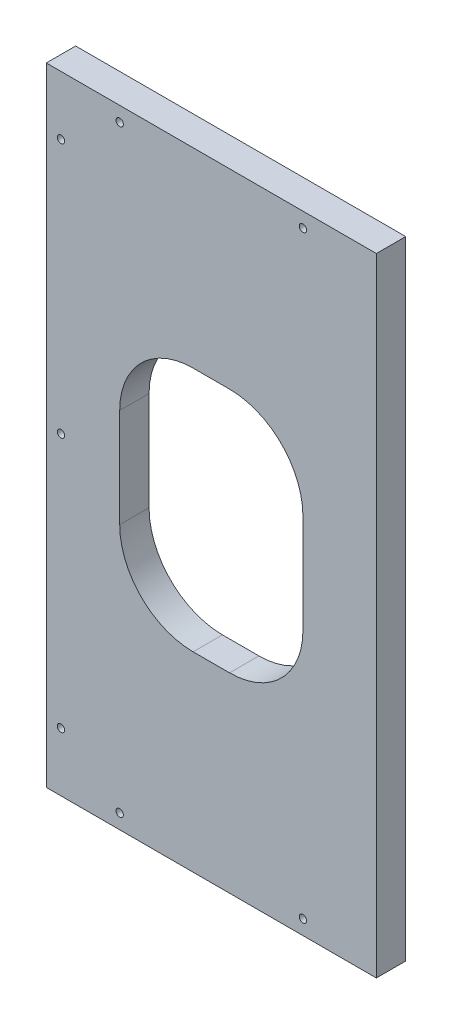
from build123d import *

# Parameters (mm, degrees)
SKETCH1_W           = 142.755639788
SKETCH1_H           = 271.365530146
BOSS_EXTRUDE1_DEPTH = 12.7
HOLE1_D             = 3.175
HOLE1_DEPTH         = 31.75
HOLE1_CSINK_D       = 10.16
HOLE1_CSINK_ANGLE   = 82
HOLE1_TIP           = 0.953866233
SKETCH4_W           = 79.255639788
SKETCH4_H           = 106.265530146
CUT_EXTRUDE1_DEPTH  = 302.349406056
FILLET1_R           = 31.75


with BuildPart() as part:
    # Sketch1 → Boss-Extrude1 (new body)
    with BuildSketch(Plane.XY):
        with Locations((-163.375147287, -52.841023691)):
            Rectangle(SKETCH1_W, SKETCH1_H)
    extrude(amount=BOSS_EXTRUDE1_DEPTH)

    # Hole1
    with Locations(Plane(origin=(181.039434513, -52.974999997, 0), x_dir=(0, -1, 0), z_dir=(0, 0, -1))):
        with Locations((129.198788767, 384.042401694), (-129.466741379, 384.042401694), (-129.466741379, 304.786761906), (-110.416741379, 409.442401694), (-0.133976306, 409.442401694), (110.148788767, 409.442401694), (129.198788767, 304.786761906)):
            CounterSinkHole(HOLE1_D / 2, HOLE1_CSINK_D / 2, depth=HOLE1_DEPTH, counter_sink_angle=HOLE1_CSINK_ANGLE)
            with Locations((0, 0, -(HOLE1_DEPTH + HOLE1_TIP / 2))):  # 118° drill point
                Cone(0, HOLE1_D / 2, HOLE1_TIP, mode=Mode.SUBTRACT)

    # Sketch4 → Cut-Extrude1 (cut, through all)
    with BuildSketch(Plane.XY.offset(12.7)):
        with Locations((-163.375147287, -52.841023691)):
            Rectangle(SKETCH4_W, SKETCH4_H)
    extrude(amount=-CUT_EXTRUDE1_DEPTH, mode=Mode.SUBTRACT)

    # Fillet1
    fillet1_edges = [part.edges().sort_by_distance(p)[0] for p in [
        (-123.747327393, -105.973788764, 6.35),
        (-123.747327393, 0.291741382, 6.35),
        (-203.002967181, 0.291741382, 6.35),
        (-203.002967181, -105.973788764, 6.35),
    ]]
    fillet(fillet1_edges, radius=FILLET1_R)


solid = part.part
